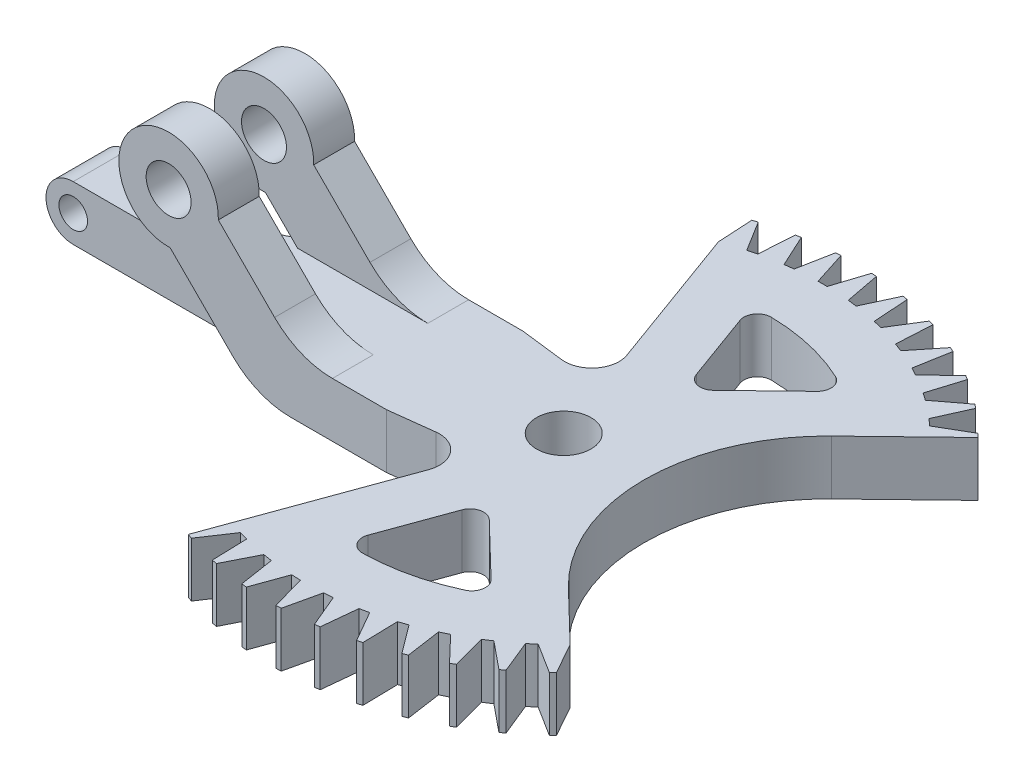
from build123d import *

# Parameters (mm, degrees)
SKETCH1_R           = 1.65
BOSS_EXTRUDE1_DEPTH = 5
SKETCH3_W           = 10.114466094
SKETCH3_H           = 4
CUT_EXTRUDE1_DEPTH  = 22.617643257
SKETCH4_R           = 2
BOSS_EXTRUDE2_DEPTH = 4
SKETCH5_R           = 1.05
BOSS_EXTRUDE3_DEPTH = 2
CUT_EXTRUDE2_REACH  = 48.969
SKETCH8_W           = 3.071067812
SKETCH8_H           = 4
CUT_EXTRUDE4_DEPTH  = 4
CIRPATTERN1_COUNT   = 10
CIRPATTERN1_ANGLE   = 63
CUT_EXTRUDE3_REACH  = 48.969
CIRPATTERN2_COUNT   = 10
CIRPATTERN2_ANGLE   = 63
FILLET1_R           = 6
FILLET2_R           = 2
CUT_EXTRUDE5_REACH  = 47.965


with BuildPart() as part:
    # Sketch1 → Boss-Extrude1 (new, symmetric)
    with BuildSketch(Plane.XY):
        with BuildLine():
            Line((6.464466094, -10), (16, -10))
            Line((16, -10), (16, -6))
            Line((16, -6), (9.535533906, -6))
            Line((9.535533906, -6), (3.64825891, -0.112725004))
            ThreePointArc((3.64825891, -0.112725004), (-2.580939751, 2.580939751), (0.112725004, -3.64825891))
            Line((0.112725004, -3.64825891), (6.464466094, -10))
        make_face()
        Circle(SKETCH1_R, mode=Mode.SUBTRACT)
    extrude(amount=BOSS_EXTRUDE1_DEPTH, both=True)

    # Sketch3 → Cut-Extrude1 (cut, through all)
    with BuildSketch(Plane.XZ.offset(10)):
        with Locations((1.407233047, 0)):
            Rectangle(SKETCH3_W, SKETCH3_H)
    extrude(amount=-CUT_EXTRUDE1_DEPTH, mode=Mode.SUBTRACT)

    # Sketch4 → Boss-Extrude2 (add)
    with BuildSketch(Plane.XZ.offset(10)):
        with BuildLine():
            Line((16, 5), (16, -5))
            Line((16, -5), (19.230936694, -4.60798069))
            ThreePointArc((19.230936694, -4.60798069), (21.037942245, -5.349509921), (21.351221233, -7.277459852))
            Line((21.351221233, -7.277459852), (16.646566918, -20.203391347))
            ThreePointArc((16.646566918, -20.203391347), (28.836447668, -20.948956393), (39.465805707, -14.935154965))
            Line((39.465805707, -14.935154965), (34, -9.656887748))
            ThreePointArc((34, -9.656887748), (29.900894348, 0), (34, 9.656887748))
            Line((34, 9.656887748), (39.465805707, 14.935154965))
            ThreePointArc((39.465805707, 14.935154965), (28.836447668, 20.948956393), (16.646566918, 20.203391347))
            Line((16.646566918, 20.203391347), (21.351221233, 7.277459852))
            ThreePointArc((21.351221233, 7.277459852), (21.037942245, 5.349509921), (19.230936694, 4.60798069))
            Line((19.230936694, 4.60798069), (16, 5))
        make_face()
        with Locations(Location((24, 0, 0), (0, 0, 270))):
            Circle(SKETCH4_R, mode=Mode.SUBTRACT)
    extrude(amount=-BOSS_EXTRUDE2_DEPTH)

    # Sketch5 → Boss-Extrude3 (add, symmetric)
    with BuildSketch(Plane.XY):
        with BuildLine():
            Line((6.464466094, -10), (-10, -10))
            ThreePointArc((-10, -10), (-12, -8), (-10, -6))
            Line((-10, -6), (9.535533906, -6))
            Line((9.535533906, -6), (16, -6))
            Line((16, -6), (16, -10))
            Line((16, -10), (6.464466094, -10))
        make_face()
        with Locations((-10, -8)):
            Circle(SKETCH5_R, mode=Mode.SUBTRACT)
    extrude(amount=BOSS_EXTRUDE3_DEPTH, both=True)

    # Sketch6 → Cut-Extrude2 (cut, up to next)
    with BuildSketch(Plane.XZ.offset(10), mode=Mode.PRIVATE) as cut_extrude2_sk1:
        with BuildLine():
            Line((38.935154965, 15.465805707), (37.667456206, 13.198509039))
            ThreePointArc((37.667456206, 13.198509039), (37.895720331, 12.957968841), (38.119751684, 12.713481521))
            Line((38.119751684, 12.713481521), (40.469955527, 13.819933608))
            ThreePointArc((40.469955527, 13.819933608), (39.724104585, 14.662964741), (38.935154965, 15.465805707))
        make_face()
    cut_extrude2_tool1 = extrude(cut_extrude2_sk1.sketch, amount=-CUT_EXTRUDE2_REACH, mode=Mode.PRIVATE) & part.part
    cut_extrude2 = cut_extrude2_tool1.solids().sort_by_distance((38.971777, -10, 13.961408))[0]
    add(cut_extrude2, mode=Mode.SUBTRACT)

    # Sketch8 → Cut-Extrude4 (cut)
    with BuildSketch(Plane(origin=(0, -6, 0), x_dir=(1, 0, 0), z_dir=(0, 1, 0))):
        with Locations((8, 0)):
            Rectangle(SKETCH8_W, SKETCH8_H)
    extrude(amount=CUT_EXTRUDE4_DEPTH, mode=Mode.SUBTRACT)

    # CirPattern1: Cut-Extrude2; each copy of Cut-Extrude2 runs up to whatever stops it at its own place
    cirpattern1_before = part.part  # the part as the pattern finds it: every copy runs up to it
    cirpattern1_cut_extrude2_long = extrude(cut_extrude2_sk1.sketch, amount=-CUT_EXTRUDE2_REACH, mode=Mode.PRIVATE)
    cirpattern1_cut_extrude2_tool1 = cirpattern1_cut_extrude2_long.rotate(Axis((24, 0, 0), (0, -1, 0)), 1 * CIRPATTERN1_ANGLE / (CIRPATTERN1_COUNT - 1)) & cirpattern1_before
    add(cirpattern1_cut_extrude2_tool1.solids().sort_by_distance((37.158712, -10, 15.681942))[0], mode=Mode.SUBTRACT)
    cirpattern1_cut_extrude2_tool2 = cirpattern1_cut_extrude2_long.rotate(Axis((24, 0, 0), (0, -1, 0)), 2 * CIRPATTERN1_ANGLE / (CIRPATTERN1_COUNT - 1)) & cirpattern1_before
    add(cirpattern1_cut_extrude2_tool2.solids().sort_by_distance((35.149481, -10, 17.168695))[0], mode=Mode.SUBTRACT)
    cirpattern1_cut_extrude2_tool3 = cirpattern1_cut_extrude2_long.rotate(Axis((24, 0, 0), (0, -1, 0)), 3 * CIRPATTERN1_ANGLE / (CIRPATTERN1_COUNT - 1)) & cirpattern1_before
    add(cirpattern1_cut_extrude2_tool3.solids().sort_by_distance((32.974037, -10, 18.399502))[0], mode=Mode.SUBTRACT)
    cirpattern1_cut_extrude2_tool4 = cirpattern1_cut_extrude2_long.rotate(Axis((24, 0, 0), (0, -1, 0)), 4 * CIRPATTERN1_ANGLE / (CIRPATTERN1_COUNT - 1)) & cirpattern1_before
    add(cirpattern1_cut_extrude2_tool4.solids().sort_by_distance((30.66481, -10, 19.356015))[0], mode=Mode.SUBTRACT)
    cirpattern1_cut_extrude2_tool5 = cirpattern1_cut_extrude2_long.rotate(Axis((24, 0, 0), (0, -1, 0)), 5 * CIRPATTERN1_ANGLE / (CIRPATTERN1_COUNT - 1)) & cirpattern1_before
    add(cirpattern1_cut_extrude2_tool5.solids().sort_by_distance((28.256227, -10, 20.023974))[0], mode=Mode.SUBTRACT)
    cirpattern1_cut_extrude2_tool6 = cirpattern1_cut_extrude2_long.rotate(Axis((24, 0, 0), (0, -1, 0)), 6 * CIRPATTERN1_ANGLE / (CIRPATTERN1_COUNT - 1)) & cirpattern1_before
    add(cirpattern1_cut_extrude2_tool6.solids().sort_by_distance((25.784193, -10, 20.393422))[0], mode=Mode.SUBTRACT)
    cirpattern1_cut_extrude2_tool7 = cirpattern1_cut_extrude2_long.rotate(Axis((24, 0, 0), (0, -1, 0)), 7 * CIRPATTERN1_ANGLE / (CIRPATTERN1_COUNT - 1)) & cirpattern1_before
    add(cirpattern1_cut_extrude2_tool7.solids().sort_by_distance((23.285561, -10, 20.458851))[0], mode=Mode.SUBTRACT)
    cirpattern1_cut_extrude2_tool8 = cirpattern1_cut_extrude2_long.rotate(Axis((24, 0, 0), (0, -1, 0)), 8 * CIRPATTERN1_ANGLE / (CIRPATTERN1_COUNT - 1)) & cirpattern1_before
    add(cirpattern1_cut_extrude2_tool8.solids().sort_by_distance((20.79758, -10, 20.219286))[0], mode=Mode.SUBTRACT)
    cirpattern1_cut_extrude2_tool9 = cirpattern1_cut_extrude2_long.rotate(Axis((24, 0, 0), (0, -1, 0)), 9 * CIRPATTERN1_ANGLE / (CIRPATTERN1_COUNT - 1)) & cirpattern1_before
    add(cirpattern1_cut_extrude2_tool9.solids().sort_by_distance((18.357339, -10, 19.678298))[0], mode=Mode.SUBTRACT)

    # Sketch7 → Cut-Extrude3 (cut, up to next)
    with BuildSketch(Plane.XZ.offset(10), mode=Mode.PRIVATE) as cut_extrude3_sk1:
        with BuildLine():
            Line((15.255162174, -19.641227339), (16.882474725, -17.616493237))
            ThreePointArc((16.882474725, -17.616493237), (17.191008959, -17.738028103), (17.501617277, -17.854159795))
            Line((17.501617277, -17.854159795), (17.356134621, -20.4477151))
            ThreePointArc((17.356134621, -20.4477151), (16.295089085, -20.07197917), (15.255162174, -19.641227339))
        make_face()
    cut_extrude3_tool1 = extrude(cut_extrude3_sk1.sketch, amount=-CUT_EXTRUDE3_REACH, mode=Mode.PRIVATE) & part.part
    cut_extrude3 = cut_extrude3_tool1.solids().sort_by_distance((16.663734, -10, -19.111626))[0]
    add(cut_extrude3, mode=Mode.SUBTRACT)

    # CirPattern2: Cut-Extrude3; each copy of Cut-Extrude3 runs up to whatever stops it at its own place
    cirpattern2_before = part.part  # the part as the pattern finds it: every copy runs up to it
    cirpattern2_cut_extrude3_long = extrude(cut_extrude3_sk1.sketch, amount=-CUT_EXTRUDE3_REACH, mode=Mode.PRIVATE)
    cirpattern2_cut_extrude3_tool1 = cirpattern2_cut_extrude3_long.rotate(Axis((24, 0, 0), (0, -1, 0)), 1 * CIRPATTERN2_ANGLE / (CIRPATTERN2_COUNT - 1)) & cirpattern2_before
    add(cirpattern2_cut_extrude3_tool1.solids().sort_by_distance((19.047539, -10, -19.863237))[0], mode=Mode.SUBTRACT)
    cirpattern2_cut_extrude3_tool2 = cirpattern2_cut_extrude3_long.rotate(Axis((24, 0, 0), (0, -1, 0)), 2 * CIRPATTERN2_ANGLE / (CIRPATTERN2_COUNT - 1)) & cirpattern2_before
    add(cirpattern2_cut_extrude3_tool2.solids().sort_by_distance((21.505173, -10, -20.318732))[0], mode=Mode.SUBTRACT)
    cirpattern2_cut_extrude3_tool3 = cirpattern2_cut_extrude3_long.rotate(Axis((24, 0, 0), (0, -1, 0)), 3 * CIRPATTERN2_ANGLE / (CIRPATTERN2_COUNT - 1)) & cirpattern2_before
    add(cirpattern2_cut_extrude3_tool3.solids().sort_by_distance((24, -10, -20.471323))[0], mode=Mode.SUBTRACT)
    cirpattern2_cut_extrude3_tool4 = cirpattern2_cut_extrude3_long.rotate(Axis((24, 0, 0), (0, -1, 0)), 4 * CIRPATTERN2_ANGLE / (CIRPATTERN2_COUNT - 1)) & cirpattern2_before
    add(cirpattern2_cut_extrude3_tool4.solids().sort_by_distance((26.494827, -10, -20.318732))[0], mode=Mode.SUBTRACT)
    cirpattern2_cut_extrude3_tool5 = cirpattern2_cut_extrude3_long.rotate(Axis((24, 0, 0), (0, -1, 0)), 5 * CIRPATTERN2_ANGLE / (CIRPATTERN2_COUNT - 1)) & cirpattern2_before
    add(cirpattern2_cut_extrude3_tool5.solids().sort_by_distance((28.952461, -10, -19.863237))[0], mode=Mode.SUBTRACT)
    cirpattern2_cut_extrude3_tool6 = cirpattern2_cut_extrude3_long.rotate(Axis((24, 0, 0), (0, -1, 0)), 6 * CIRPATTERN2_ANGLE / (CIRPATTERN2_COUNT - 1)) & cirpattern2_before
    add(cirpattern2_cut_extrude3_tool6.solids().sort_by_distance((31.336266, -10, -19.111626))[0], mode=Mode.SUBTRACT)
    cirpattern2_cut_extrude3_tool7 = cirpattern2_cut_extrude3_long.rotate(Axis((24, 0, 0), (0, -1, 0)), 7 * CIRPATTERN2_ANGLE / (CIRPATTERN2_COUNT - 1)) & cirpattern2_before
    add(cirpattern2_cut_extrude3_tool7.solids().sort_by_distance((33.610704, -10, -18.075105))[0], mode=Mode.SUBTRACT)
    cirpattern2_cut_extrude3_tool8 = cirpattern2_cut_extrude3_long.rotate(Axis((24, 0, 0), (0, -1, 0)), 8 * CIRPATTERN2_ANGLE / (CIRPATTERN2_COUNT - 1)) & cirpattern2_before
    add(cirpattern2_cut_extrude3_tool8.solids().sort_by_distance((35.741868, -10, -16.769126))[0], mode=Mode.SUBTRACT)
    cirpattern2_cut_extrude3_tool9 = cirpattern2_cut_extrude3_long.rotate(Axis((24, 0, 0), (0, -1, 0)), 9 * CIRPATTERN2_ANGLE / (CIRPATTERN2_COUNT - 1)) & cirpattern2_before
    add(cirpattern2_cut_extrude3_tool9.solids().sort_by_distance((37.697988, -10, -15.213158))[0], mode=Mode.SUBTRACT)

    # Fillet1
    fillet1_edges = [part.edges().sort_by_distance(p)[0] for p in [
        (6.464466094, -10, 3.5),
        (9.535533906, -6, 3.5),
        (9.535533906, -6, -3.5),
        (6.464466094, -10, -3.5),
    ]]
    fillet(fillet1_edges, radius=FILLET1_R)

    # Fillet2
    # the kernel refuses this fillet: 2 mm, written as the material it adds along each edge
    with BuildSketch(Plane(origin=(-1.071067812, -2.464466094, -2), x_dir=(0, 0, -1), z_dir=(0.7071067811865491, -0.707106781186546, 0))) as fillet2_piece_1_section:
        with BuildLine():
            CenterArc((FILLET2_R, -FILLET2_R), FILLET2_R, 90, 90)
            Line((0, -FILLET2_R), (0, 0))
            Line((0, 0), (FILLET2_R, 0))
        make_face()
    fillet2_piece_1 = extrude(amount=8.171572875, mode=Mode.PRIVATE)
    fillet2_piece_1 = split(fillet2_piece_1, bisect_by=Plane(origin=(3.070726254, -6, -2.423870706), z_dir=(0, -1, 0)), keep=Keep.TOP, mode=Mode.PRIVATE)
    add(fillet2_piece_1)
    with BuildSketch(Plane(origin=(8.949747468, -4, -2), x_dir=(-0.7071067811865458, -0.7071067811865492, 0), z_dir=(-0.7071067811865492, 0.7071067811865458, 0))) as fillet2_piece_2_section:
        with BuildLine():
            CenterArc((6 + FILLET2_R, -FILLET2_R), FILLET2_R, 90, 90)
            Line((6 + FILLET2_R, 0), (6, 0))
            Line((6, 0), (6, -FILLET2_R))
        make_face()
    fillet2_piece_2 = revolve(axis=Axis((8.949747468, -4, -2), (0, 0, 1)), revolution_arc=92.751276954, mode=Mode.PRIVATE)
    fillet2_piece_2 = split(fillet2_piece_2, bisect_by=Plane(origin=(6.626511668, -10, -2.690615954), z_dir=(0, 1, 0)), keep=Keep.TOP, mode=Mode.PRIVATE)
    add(fillet2_piece_2)
    with BuildSketch(Plane(origin=(8.949747468, -4, 2), x_dir=(0.7402331123820542, -0.6723503099822121, 0), z_dir=(0.6723503099822121, 0.7402331123820542, 0))) as fillet2_piece_3_section:
        with BuildLine():
            CenterArc((6 + FILLET2_R, -FILLET2_R), FILLET2_R, 90, 90)
            Line((6 + FILLET2_R, 0), (6, 0))
            Line((6, 0), (6, -FILLET2_R))
        make_face()
    fillet2_piece_3 = revolve(axis=Axis((8.949747468, -4, 2), (0, 0, -1)), revolution_arc=92.751276954, mode=Mode.PRIVATE)
    fillet2_piece_3 = split(fillet2_piece_3, bisect_by=Plane(origin=(6.626511695, -10, 2.690616224), z_dir=(0, 1, 0)), keep=Keep.TOP, mode=Mode.PRIVATE)
    add(fillet2_piece_3)
    with BuildSketch(Plane(origin=(4.707106781, -8.242640687, 2), x_dir=(0, 0, 1), z_dir=(-0.7071067811865491, 0.707106781186546, 0))) as fillet2_piece_4_section:
        with BuildLine():
            CenterArc((FILLET2_R, -FILLET2_R), FILLET2_R, 90, 90)
            Line((0, -FILLET2_R), (0, 0))
            Line((0, 0), (FILLET2_R, 0))
        make_face()
    fillet2_piece_4 = extrude(amount=8.171572875, mode=Mode.PRIVATE)
    fillet2_piece_4 = split(fillet2_piece_4, bisect_by=Plane(origin=(3.070726254, -6, 2.423870706), z_dir=(0, -1, 0)), keep=Keep.TOP, mode=Mode.PRIVATE)
    add(fillet2_piece_4)

    # Sketch9 → Cut-Extrude5 (cut, up to next)
    with BuildSketch(Plane(origin=(0, -6, 0), x_dir=(1, 0, 0), z_dir=(0, 1, 0)), mode=Mode.PRIVATE) as cut_extrude5_sk1:
        with BuildLine():
            Line((25.125446305, -8.603079291), (23.286276759, -13.656156089))
            ThreePointArc((23.286276759, -13.656156089), (23.411473118, -14.578345036), (24.24211005, -14.998045964))
            ThreePointArc((24.24211005, -14.998045964), (27.374265815, -14.615550972), (30.357103537, -13.586288478))
            ThreePointArc((30.357103537, -13.586288478), (30.919690289, -12.844936519), (30.627955005, -11.961196113))
            Line((30.627955005, -11.961196113), (26.759797296, -8.225759634))
            ThreePointArc((26.759797296, -8.225759634), (25.840187871, -7.970729369), (25.125446305, -8.603079291))
        make_face()
    cut_extrude5_tool1 = extrude(cut_extrude5_sk1.sketch, amount=-CUT_EXTRUDE5_REACH, mode=Mode.PRIVATE) & part.part
    cut_extrude5 = cut_extrude5_tool1.solids().sort_by_distance((26.769457, -6, 11.995835))[0]
    add(cut_extrude5, mode=Mode.SUBTRACT)

    # Mirror1: Cut-Extrude5 across plane
    add(cut_extrude5.mirror(Plane.XY), mode=Mode.SUBTRACT)


solid = part.part
